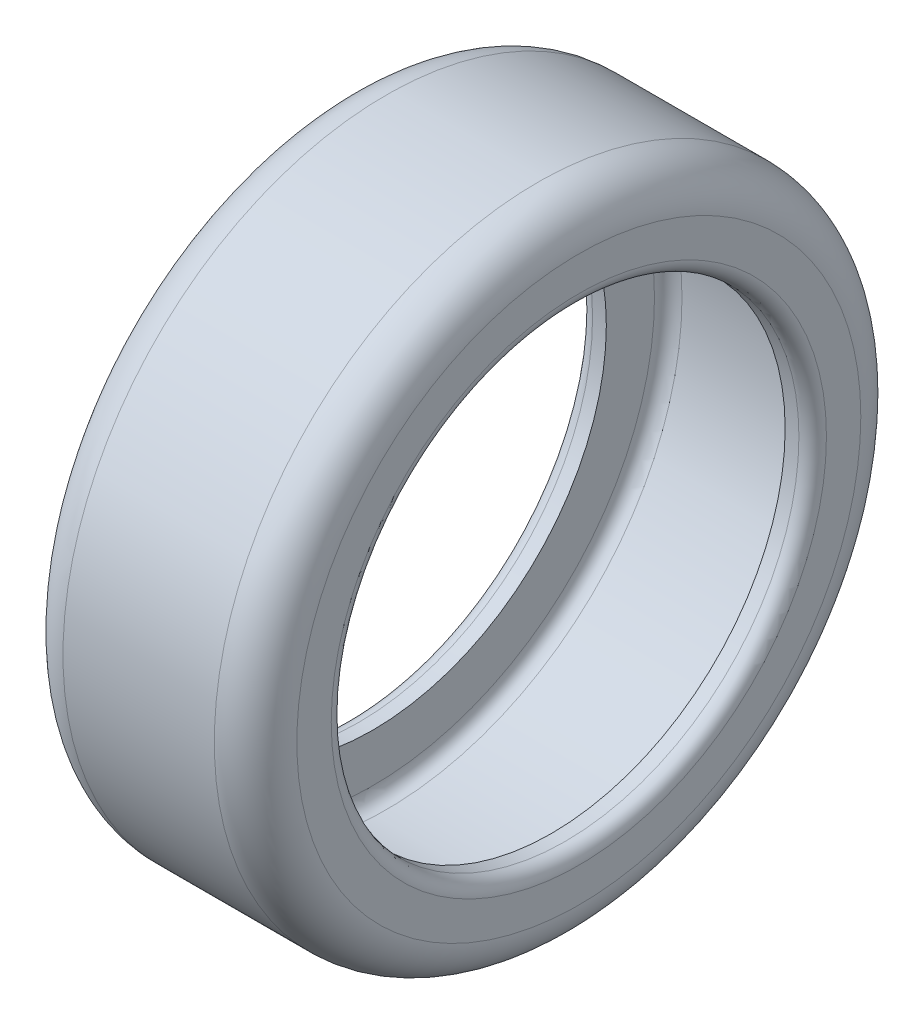
from build123d import *

# Parameters (mm, degrees)
SKETCH1_R           = 23.5
SKETCH1_R_2         = 17
BOSS_EXTRUDE2_DEPTH = 17
FILLET1_R           = 3
FILLET2_R           = 1


# Read off the part's stored shape, not the designer's step: Shell1
with BuildPart() as part:
    # Sketch1 → Boss-Extrude2 (new body)
    with BuildSketch(Plane(origin=(0, 0, 0), x_dir=(0, 0, -1), z_dir=(1, 0, 0))):
        Circle(SKETCH1_R)
        Circle(SKETCH1_R_2, mode=Mode.SUBTRACT)
    extrude(amount=BOSS_EXTRUDE2_DEPTH)

    # Fillet1
    fillet1_edges = [part.edges().sort_by_distance(p)[0] for p in [
        (0, 0, 23.5),
        (17, 0, 23.5),
    ]]
    fillet(fillet1_edges, radius=FILLET1_R)

    # Fillet2
    fillet2_edges = [part.edges().sort_by_distance(p)[0] for p in [
        (0, 0, 17),
        (17, 0, 17),
    ]]
    fillet(fillet2_edges, radius=FILLET2_R)

    # Shell1 outline → Shell1 (revolve, cut)
    with BuildSketch(Plane.YX):
        with BuildLine():
            Line((20.5, 15), (17, 15))
            Line((17, 15), (17, 2))
            Line((17, 2), (20.5, 2))
            ThreePointArc((20.5, 2), (21.207106781, 2.292893219), (21.5, 3))
            Line((21.5, 3), (21.5, 14))
            ThreePointArc((21.5, 14), (21.207106781, 14.707106781), (20.5, 15))
        make_face()
    revolve(axis=Axis((0, 0, 0), (1, 0, 0)), mode=Mode.SUBTRACT)


solid = part.part
